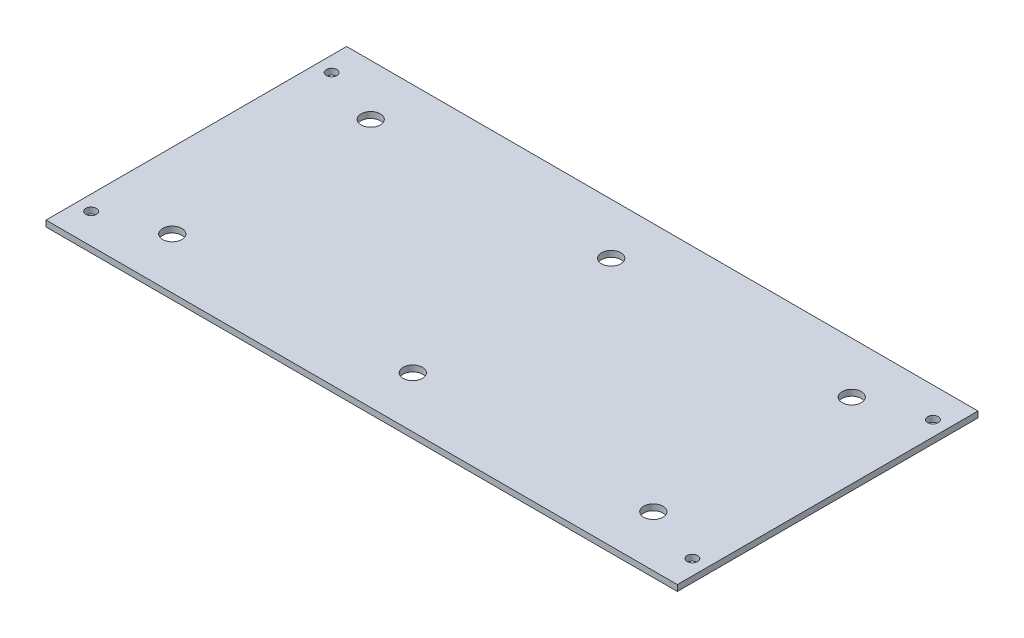
from build123d import *

# Parameters (mm, degrees)
SKETCH_1_W      = 210
SKETCH_1_H      = 100
SKETCH_1_R      = 3.2
SKETCH_1_R_2    = 1.75
EXTRUDE_1_DEPTH = 2


with BuildPart() as part:
    # Эскиз1 → Бобышка-Вытянуть1 (new body)
    with BuildSketch(Plane(origin=(0, 0, 0), x_dir=(1, 0, 0), z_dir=(0, 1, 0))):
        with Locations((105, 50)):
            Rectangle(SKETCH_1_W, SKETCH_1_H)
        with Locations((105, 17)):
            Circle(SKETCH_1_R, mode=Mode.SUBTRACT)
        with Locations((185, 17)):
            Circle(SKETCH_1_R, mode=Mode.SUBTRACT)
        with Locations((25, 17)):
            Circle(SKETCH_1_R, mode=Mode.SUBTRACT)
        with Locations((25, 83)):
            Circle(SKETCH_1_R, mode=Mode.SUBTRACT)
        with Locations((105, 83)):
            Circle(SKETCH_1_R, mode=Mode.SUBTRACT)
        with Locations((185, 83)):
            Circle(SKETCH_1_R, mode=Mode.SUBTRACT)
        with Locations((5, 10)):
            Circle(SKETCH_1_R_2, mode=Mode.SUBTRACT)
        with Locations((5, 90)):
            Circle(SKETCH_1_R_2, mode=Mode.SUBTRACT)
        with Locations((205, 10)):
            Circle(SKETCH_1_R_2, mode=Mode.SUBTRACT)
        with Locations((205, 90)):
            Circle(SKETCH_1_R_2, mode=Mode.SUBTRACT)
    extrude(amount=EXTRUDE_1_DEPTH)


solid = part.part
